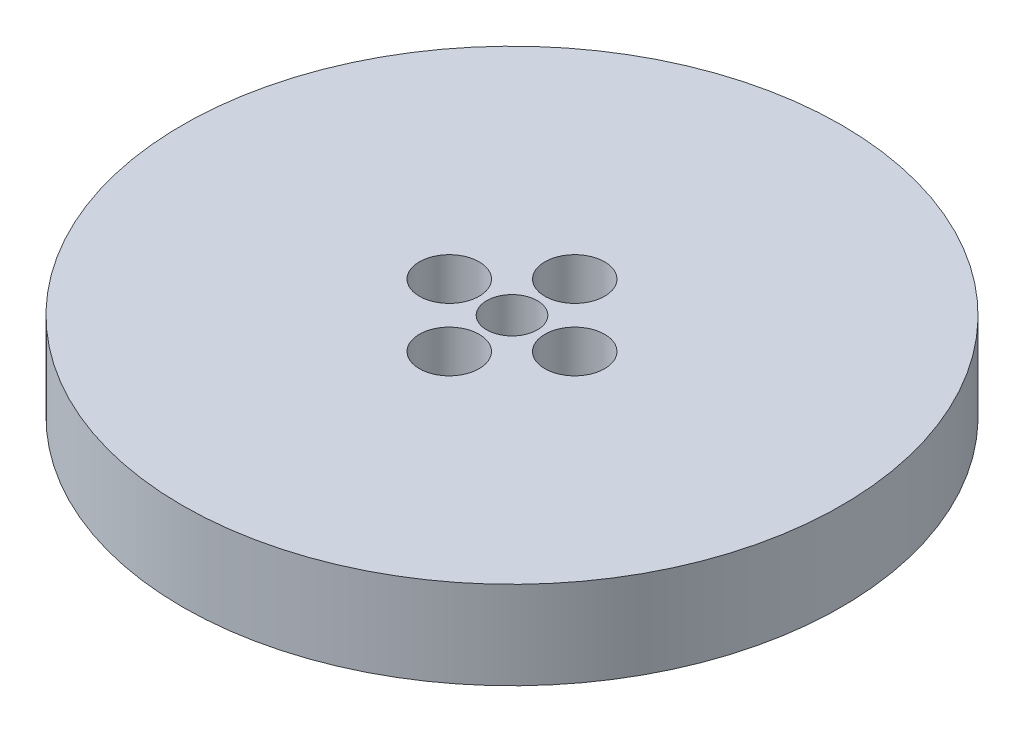
from build123d import *

# Parameters (mm, degrees)
SKETCH1_R           = 97.5
BOSS_EXTRUDE1_DEPTH = 26
SKETCH2_R           = 7.5
CUT_EXTRUDE1_DEPTH  = 141.315715442
SKETCH3_R           = 8.839911671
CUT_EXTRUDE2_DEPTH  = 23.024400514
CIRPATTERN1_COUNT   = 4


with BuildPart() as part:
    # Sketch1 → Boss-Extrude1 (new body)
    with BuildSketch(Plane(origin=(0, 0, 0), x_dir=(1, 0, 0), z_dir=(0, 1, 0))):
        Circle(SKETCH1_R)
    extrude(amount=BOSS_EXTRUDE1_DEPTH)

    # Sketch2 → Cut-Extrude1 (cut, through all)
    with BuildSketch(Plane(origin=(0, 0, 0), x_dir=(1, 0, 0), z_dir=(0, 1, 0))):
        Circle(SKETCH2_R)
    extrude(amount=CUT_EXTRUDE1_DEPTH, mode=Mode.SUBTRACT)

    # Sketch3 → Cut-Extrude2 (cut)
    with BuildSketch(Plane(origin=(0, 26, 0), x_dir=(1, 0, 0), z_dir=(0, 1, 0))):
        with Locations((-18.56351447, 0)):
            Circle(SKETCH3_R)
    cut_extrude2 = extrude(amount=-CUT_EXTRUDE2_DEPTH, mode=Mode.SUBTRACT)

    # CirPattern1: Cut-Extrude2 ×4 about axis
    cirpattern1_axis = Axis((0, 0, 0), (0, 1, 0))
    for i in range(1, CIRPATTERN1_COUNT):
        add(cut_extrude2.rotate(cirpattern1_axis, i * 360 / CIRPATTERN1_COUNT), mode=Mode.SUBTRACT)


solid = part.part
